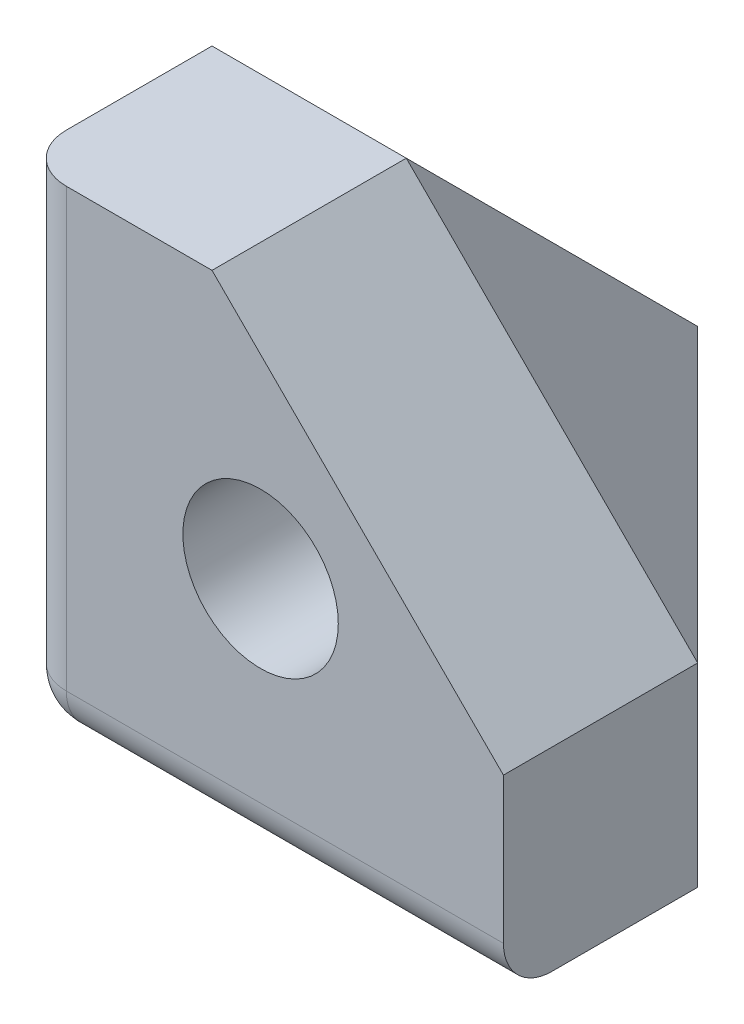
from build123d import *

# Parameters (mm, degrees)
SKETCH1_W           = 10
SKETCH1_H           = 10
BOSS_EXTRUDE1_DEPTH = 10
SKETCH2_R           = 1.6
CUT_EXTRUDE1_DEPTH  = 3.2
SKETCH3_R           = 1.6
CUT_EXTRUDE3_DEPTH  = 3.2
SKETCH4_R           = 1.6
CUT_EXTRUDE4_DEPTH  = 3.2
FILLET2_R           = 1
CHAMFER1_SIZE       = 6


with BuildPart() as part:
    # Sketch1 → Boss-Extrude1 (new body)
    with BuildSketch(Plane(origin=(0, 0, 0), x_dir=(1, 0, 0), z_dir=(0, 1, 0))):
        Rectangle(SKETCH1_W, SKETCH1_H)
    extrude(amount=BOSS_EXTRUDE1_DEPTH)

    # Sketch2 → Cut-Extrude1 (cut)
    with BuildSketch(Plane.XY.offset(5)):
        with Locations((0, 5)):
            Circle(SKETCH2_R)
    extrude(amount=-CUT_EXTRUDE1_DEPTH, mode=Mode.SUBTRACT)

    # Sketch3 → Cut-Extrude3 (cut)
    with BuildSketch(Plane(origin=(0, 0, 0), x_dir=(-1, 0, 0), z_dir=(0, -1, 0))):
        Circle(SKETCH3_R)
    extrude(amount=-CUT_EXTRUDE3_DEPTH, mode=Mode.SUBTRACT)

    # Sketch4 → Cut-Extrude4 (cut)
    with BuildSketch(Plane(origin=(-5, 0, 0), x_dir=(0, 0, -1), z_dir=(1, 0, 0))):
        with Locations((0, 5)):
            Circle(SKETCH4_R)
    extrude(amount=CUT_EXTRUDE4_DEPTH, mode=Mode.SUBTRACT)

    # Fillet2
    fillet2_edges = [part.edges().sort_by_distance(p)[0] for p in [
        (-5, 0, 0),
        (-5, 5, 5),
        (0, 0, 5),
    ]]
    fillet(fillet2_edges, radius=FILLET2_R)

    # Chamfer1
    chamfer1_edges = [part.edges().sort_by_distance(p)[0] for p in [
        (5, 5, -5),
        (5, 10, 0),
        (0, 10, -5),
    ]]
    chamfer(chamfer1_edges, length=CHAMFER1_SIZE)


solid = part.part
